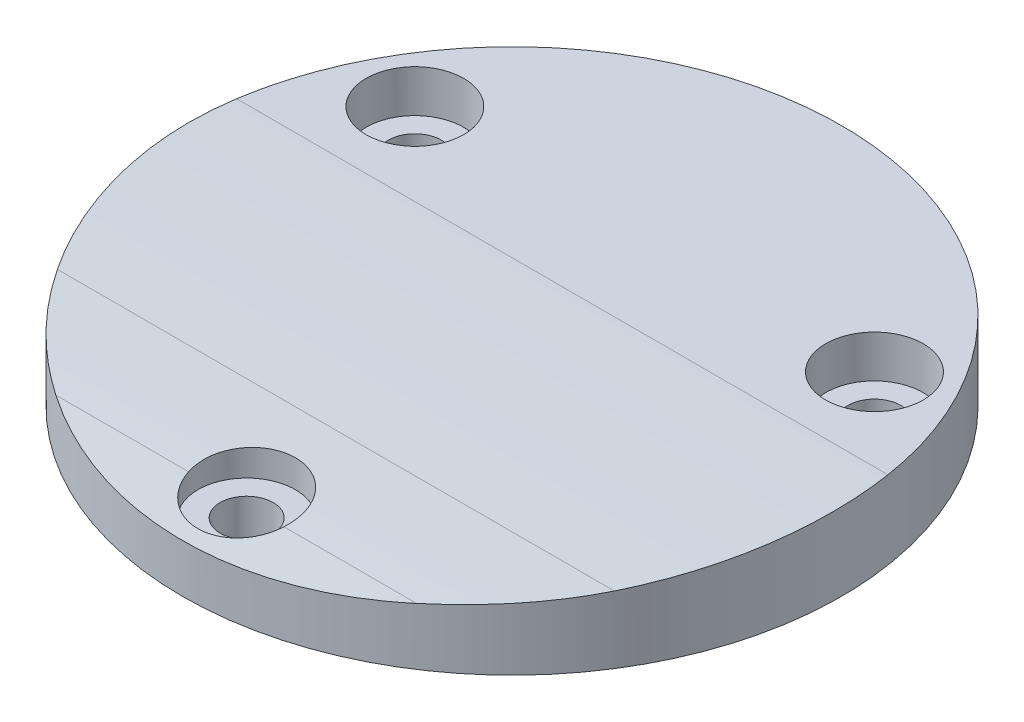
from build123d import *

# Parameters (mm, degrees)
CROQUIS1_R              = 19.25
CROQUIS1_R_2            = 1.55
SALIENTE_EXTRUIR1_DEPTH = 4.6
CROQUIS2_R              = 2.85
CORTAR_EXTRUIR1_DEPTH   = 2.5
CORTAR_EXTRUIR2_START   = -20
CORTAR_EXTRUIR2_DEPTH   = 39.25


with BuildPart() as part:
    # Croquis1 → Saliente-Extruir1 (new body)
    with BuildSketch(Plane(origin=(0, 0, 0), x_dir=(1, 0, 0), z_dir=(0, 1, 0))):
        with Locations(Location((0, 0, 0), (0, 0, 270))):
            Circle(CROQUIS1_R)
        with Locations(Location((0, -15.5, 0), (0, 0, 270))):
            Circle(CROQUIS1_R_2, mode=Mode.SUBTRACT)
        with Locations(Location((13.423393759, 7.75, 0), (0, 0, 270))):
            Circle(CROQUIS1_R_2, mode=Mode.SUBTRACT)
        with Locations(Location((-13.423393759, 7.75, 0), (0, 0, 90))):
            Circle(CROQUIS1_R_2, mode=Mode.SUBTRACT)
    extrude(amount=SALIENTE_EXTRUIR1_DEPTH)

    # Croquis2 → Cortar-Extruir1 (cut)
    with BuildSketch(Plane(origin=(0, 4.6, 0), x_dir=(1, 0, 0), z_dir=(0, 1, 0))):
        with Locations(Location((-13.423393759, 7.75, 0), (0, 0, 270))):
            Circle(CROQUIS2_R)
        with Locations(Location((0, -15.5, 0), (0, 0, 270))):
            Circle(CROQUIS2_R)
        with Locations(Location((13.423393759, 7.75, 0), (0, 0, 270))):
            Circle(CROQUIS2_R)
    extrude(amount=-CORTAR_EXTRUIR1_DEPTH, mode=Mode.SUBTRACT)

    # Cortar-Extruir2: read off the stored shape, not the designer's step
    # Cortar-Extruir2 outline → Cortar-Extruir2 (cut)
    with BuildSketch(Plane(origin=(0, 0, 0), x_dir=(0, 0, -1), z_dir=(1, 0, 0)).offset(CORTAR_EXTRUIR2_START)):
        with BuildLine():
            add(Edge.make_bspline(
                [(2.936977636, 4.574175621), (1.790244303, 4.574175621), (0.64594889, 4.558108358), (-1.067035866, 4.512526979), (-1.637451159, 4.493737954), (-2.777118659, 4.449256149), (-3.347978215, 4.423479493), (-5.04815673, 4.33666012), (-6.144965171, 4.267295894), (-8.268827136, 4.110803555), (-9.295878077, 4.023634192), (-10.286640587, 3.929863966)],
                knots=[0, 0, 0, 0, 0.25, 0.25, 0.375, 0.375, 0.5, 0.5, 0.75, 0.75, 1, 1, 1, 1], degree=3))
            Line((2.936977636, 4.574175621), (19.25, 4.574175621))
            Line((19.25, 4.574175621), (20, 4.574175621))
            Line((20, 4.574175621), (20, 28.682505432))
            Line((20, 28.682505432), (9.143406809, 28.682505432))
            add(Edge.make_bspline(
                [(9.143406809, 28.682505432), (0.711546133, 17.325043273), (-7.611623296, 9.681788834), (-15.859834912, 4.6)],
                knots=[-1.666266403, -1.666266403, -1.666266403, -1.666266403, -0.863138153, -0.863138153, -0.863138153, -0.863138153], degree=3))
            add(Edge.make_bspline(
                [(-15.859834912, 4.6), (-16.832562085, 4.000695046), (-17.80424675, 3.437014777), (-18.774944235, 2.907068479)],
                knots=[-0.863138153, -0.863138153, -0.863138153, -0.863138153, -0.768423721, -0.768423721, -0.768423721, -0.768423721], degree=3))
            add(Edge.make_bspline(
                [(-16.107826284, 3.345164552), (-16.996272574, 3.2049165), (-17.885328598, 3.058510171), (-18.774944235, 2.907068479)],
                knots=[0.576630654, 0.576630654, 0.576630654, 0.576630654, 0.604116223, 0.604116223, 0.604116223, 0.604116223], degree=3))
            add(Edge.make_bspline(
                [(-10.286640587, 3.929863966), (-11.433287768, 3.821340113), (-12.490092354, 3.733147685), (-14.431499601, 3.557604756), (-15.316034761, 3.47015491), (-16.107826284, 3.345164552)],
                knots=[0, 0, 0, 0, 0.5, 0.5, 1, 1, 1, 1], degree=3))
        make_face()
        with BuildLine():
            add(Edge.make_bspline(
                [(-18.774944235, 2.907068479), (-18.933464547, 2.880083135), (-19.092002628, 2.85293791), (-19.250558194, 2.825639157)],
                knots=[0.604116223, 0.604116223, 0.604116223, 0.604116223, 0.609013868, 0.609013868, 0.609013868, 0.609013868], degree=3))
            add(Edge.make_bspline(
                [(-15.859834912, 4.6), (-16.832562085, 4.000695046), (-17.80424675, 3.437014777), (-18.774944235, 2.907068479)],
                knots=[-0.863138153, -0.863138153, -0.863138153, -0.863138153, -0.768423721, -0.768423721, -0.768423721, -0.768423721], degree=3))
            add(Edge.make_bspline(
                [(9.143406809, 28.682505432), (0.711546133, 17.325043273), (-7.611623296, 9.681788834), (-15.859834912, 4.6)],
                knots=[-1.666266403, -1.666266403, -1.666266403, -1.666266403, -0.863138153, -0.863138153, -0.863138153, -0.863138153], degree=3))
            Line((9.143406809, 28.682505432), (-19.854758161, 28.682505432))
            Line((-19.854758161, 28.682505432), (-19.854758161, 2.720897695))
            add(Edge.make_bspline(
                [(-19.250558194, 2.825639157), (-19.451930173, 2.790968638), (-19.653330356, 2.756050479), (-19.854758161, 2.720897695)],
                knots=[0.609013868, 0.609013868, 0.609013868, 0.609013868, 0.615234074, 0.615234074, 0.615234074, 0.615234074], degree=3))
        make_face()
    extrude(amount=CORTAR_EXTRUIR2_DEPTH, mode=Mode.SUBTRACT)


solid = part.part
